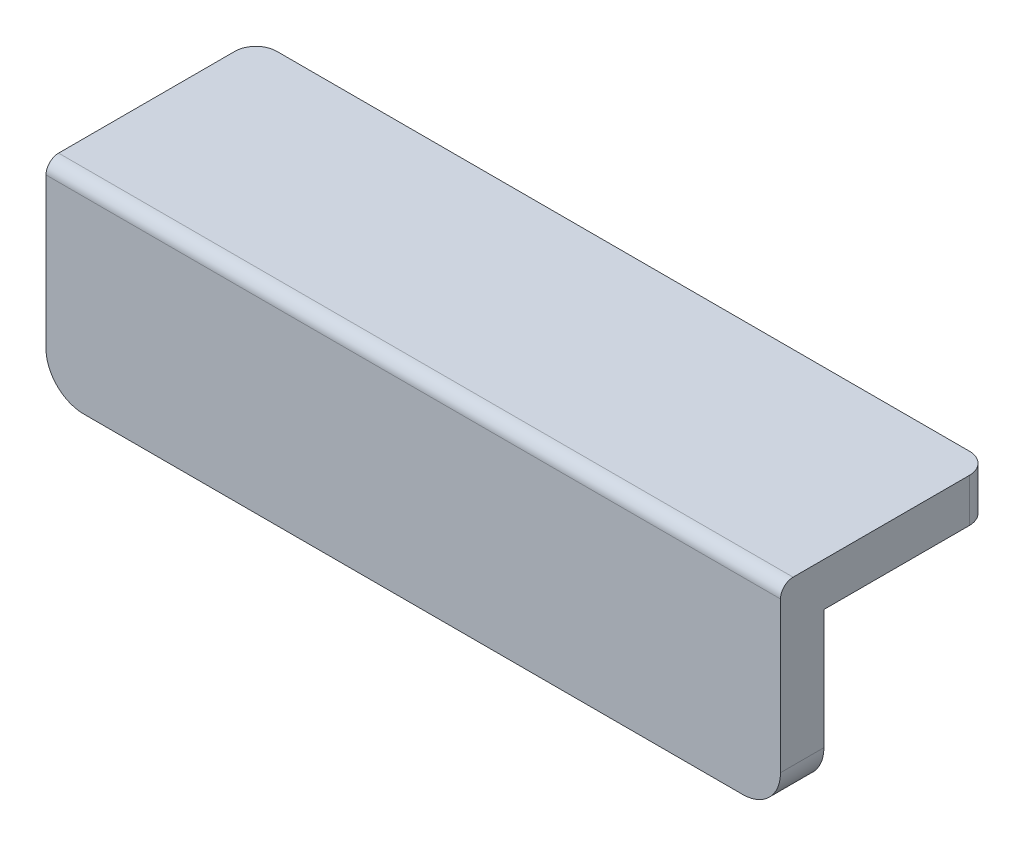
from build123d import *

# Parameters (mm, degrees)
SKETCH1_W           = 88.9
SKETCH1_H           = 19.05
BOSS_EXTRUDE1_DEPTH = 2.6289
SKETCH2_W           = 88.9
SKETCH2_H           = 25.4
BOSS_EXTRUDE2_DEPTH = 5.2578
FILLET6_R           = 4.572
FILLET7_R           = 4.572
FILLET8_R           = 1.524
FILLET9_R           = 2.54
FILLET10_R          = 2.54


with BuildPart() as part:
    # Sketch1 → Boss-Extrude1 (new, symmetric)
    with BuildSketch(Plane.XY):
        Rectangle(SKETCH1_W, SKETCH1_H)
    extrude(amount=BOSS_EXTRUDE1_DEPTH, both=True)

    # Sketch2 → Boss-Extrude2 (add)
    with BuildSketch(Plane(origin=(0, 9.525, 0), x_dir=(1, 0, 0), z_dir=(0, 1, 0))):
        with Locations((0, 10.0711)):
            Rectangle(SKETCH2_W, SKETCH2_H)
    extrude(amount=BOSS_EXTRUDE2_DEPTH)

    # Fillet6
    fillet6_edges = [part.edges().sort_by_distance(p)[0] for p in [
        (-44.45, -9.525, 0),
    ]]
    fillet(fillet6_edges, radius=FILLET6_R)

    # Fillet7
    fillet7_edges = [part.edges().sort_by_distance(p)[0] for p in [
        (44.45, -9.525, 0),
    ]]
    fillet(fillet7_edges, radius=FILLET7_R)

    # Fillet8
    fillet8_edges = [part.edges().sort_by_distance(p)[0] for p in [
        (0, 14.7828, 2.6289),
    ]]
    fillet(fillet8_edges, radius=FILLET8_R)

    # Fillet9
    fillet9_edges = [part.edges().sort_by_distance(p)[0] for p in [
        (-44.45, 12.1539, -22.7711),
    ]]
    fillet(fillet9_edges, radius=FILLET9_R)

    # Fillet10
    fillet10_edges = [part.edges().sort_by_distance(p)[0] for p in [
        (44.45, 12.1539, -22.7711),
    ]]
    fillet(fillet10_edges, radius=FILLET10_R)


solid = part.part
